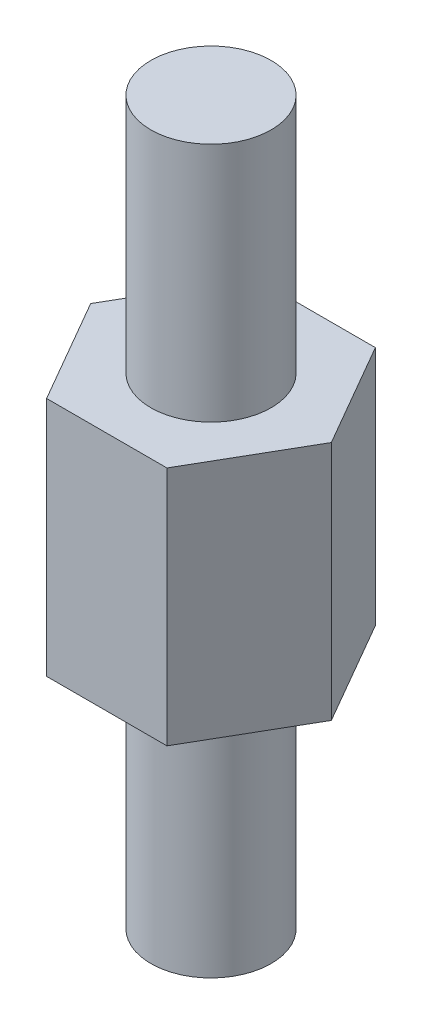
from build123d import *

# Parameters (mm, degrees)
EXTRUDE_1_DEPTH = 6
SKETCH_2_R      = 1.5
EXTRUDE_2_DEPTH = 6
EXTRUDE_START   = 6
SKETCH_3_R      = 1.5
EXTRUDE_3_DEPTH = 6


with BuildPart() as part:
    # 草图1 → 凸台-拉伸1 (new body)
    with BuildSketch(Plane(origin=(0, 0, 0), x_dir=(1, 0, 0), z_dir=(0, 1, 0))):
        Polygon((3, 0), (1.5, 2.598076211), (-1.5, 2.598076211), (-3, 0), (-1.5, -2.598076211), (1.5, -2.598076211), align=None)
    extrude(amount=EXTRUDE_1_DEPTH)

    # 草图2 → 凸台-拉伸2 (add)
    with BuildSketch(Plane(origin=(0, 6, 0), x_dir=(1, 0, 0), z_dir=(0, 1, 0))):
        Circle(SKETCH_2_R)
    extrude(amount=EXTRUDE_2_DEPTH)

    # 草图3 → 凸台-拉伸3 (add)
    with BuildSketch(Plane.XZ.offset(EXTRUDE_START)):
        Circle(SKETCH_3_R)
    extrude(amount=-EXTRUDE_3_DEPTH)


solid = part.part
